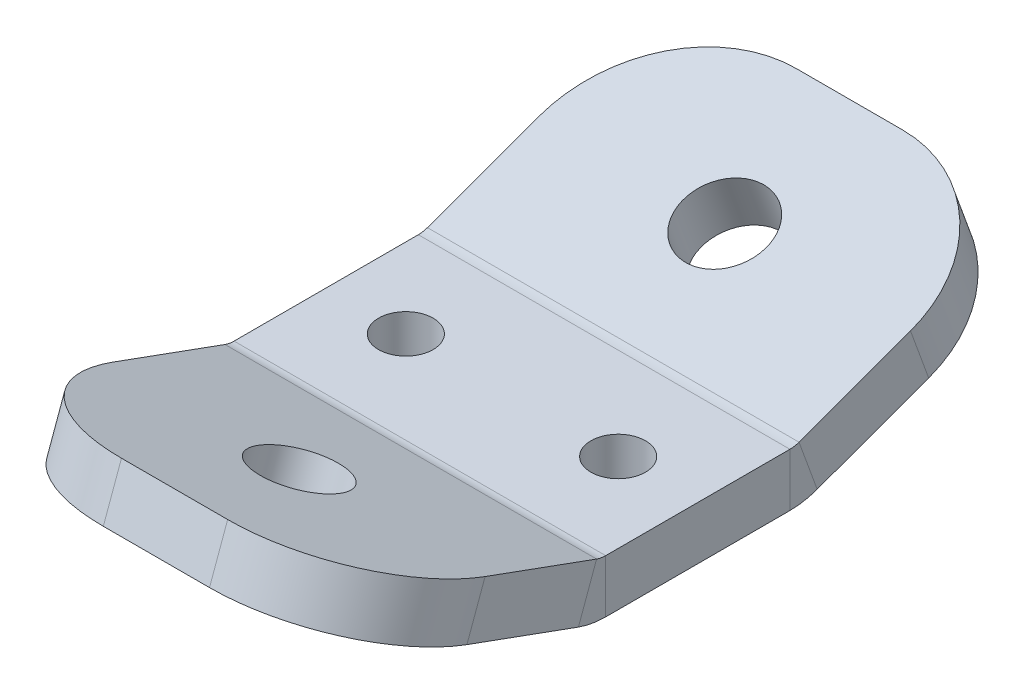
from build123d import *

# Parameters (mm, degrees)
BASE_FLANGE1_DEPTH = 22.225
FILLET1_R          = 15.875
SKETCH6_R          = 4.9657
CUT_EXTRUDE1_DEPTH = 7.62
SKETCH7_R          = 4.9657
CUT_EXTRUDE2_DEPTH = 7.62
SKETCH8_R          = 3.2639
CUT_EXTRUDE3_DEPTH = 7.62


# Sheet-metal steps are written as plain solids
with BuildPart() as part:
    # Sketch1 → Base-Flange1 (new, symmetric)
    with BuildSketch(Plane(origin=(0, 0, 0), x_dir=(0, 0, -1), z_dir=(1, 0, 0))):
        with BuildLine():
            Line((-42.53524071, 10.859139551), (-14.278227374, 0.574427787))
            ThreePointArc((-14.278227374, 0.574427787), (-12.674484401, 0.144706153), (-11.020485509, 0))
            Line((-11.020485509, 0), (11.020485509, 0))
            ThreePointArc((11.020485509, 0), (12.674484401, 0.144706153), (14.278227374, 0.574427787))
            Line((14.278227374, 0.574427787), (42.53524071, 10.859139551))
            Line((42.53524071, 10.859139551), (40.3634128, 16.826187693))
            Line((40.3634128, 16.826187693), (12.106399464, 6.541475929))
            ThreePointArc((12.106399464, 6.541475929), (11.571818473, 6.398235384), (11.020485509, 6.35))
            Line((11.020485509, 6.35), (-11.020485509, 6.35))
            ThreePointArc((-11.020485509, 6.35), (-11.571818473, 6.398235384), (-12.106399464, 6.541475929))
            Line((-12.106399464, 6.541475929), (-40.3634128, 16.826187693))
            Line((-40.3634128, 16.826187693), (-42.53524071, 10.859139551))
        make_face()
    extrude(amount=BASE_FLANGE1_DEPTH, both=True)

    # Fillet1
    fillet1_edges = [part.edges().sort_by_distance(p)[0] for p in [
        (-22.225, 13.842663622, -41.449326755),
        (-22.225, 13.842663622, 41.449326755),
        (22.225, 13.842663622, -41.449326755),
        (22.225, 13.842663622, 41.449326755),
    ]]
    fillet(fillet1_edges, radius=FILLET1_R)

    # Sketch6 → Cut-Extrude1 (cut)
    with BuildSketch(Plane(origin=(0, -4.081701322, -1.485617786), x_dir=(1, 0, 0), z_dir=(0, -0.9396926207859082, -0.34202014332566943))):
        with Locations(Location((0, -27.809096284, 0), (0, 0, 270))):
            Circle(SKETCH6_R)
    extrude(amount=-CUT_EXTRUDE1_DEPTH, mode=Mode.SUBTRACT)

    # Sketch7 → Cut-Extrude2 (cut)
    with BuildSketch(Plane(origin=(0, -4.081701322, 1.485617786), x_dir=(1, 0, 0), z_dir=(0, -0.9396926207859082, 0.34202014332566943))):
        with Locations(Location((0, 27.809096284, 0), (0, 0, 270))):
            Circle(SKETCH7_R)
    extrude(amount=-CUT_EXTRUDE2_DEPTH, mode=Mode.SUBTRACT)

    # Sketch8 → Cut-Extrude3 (cut)
    with BuildSketch(Plane.XZ):
        with Locations(Location((-12.7, 0, 0), (0, 0, 270))):
            Circle(SKETCH8_R)
        with Locations(Location((12.7, 0, 0), (0, 0, 270))):
            Circle(SKETCH8_R)
    extrude(amount=-CUT_EXTRUDE3_DEPTH, mode=Mode.SUBTRACT)


solid = part.part
